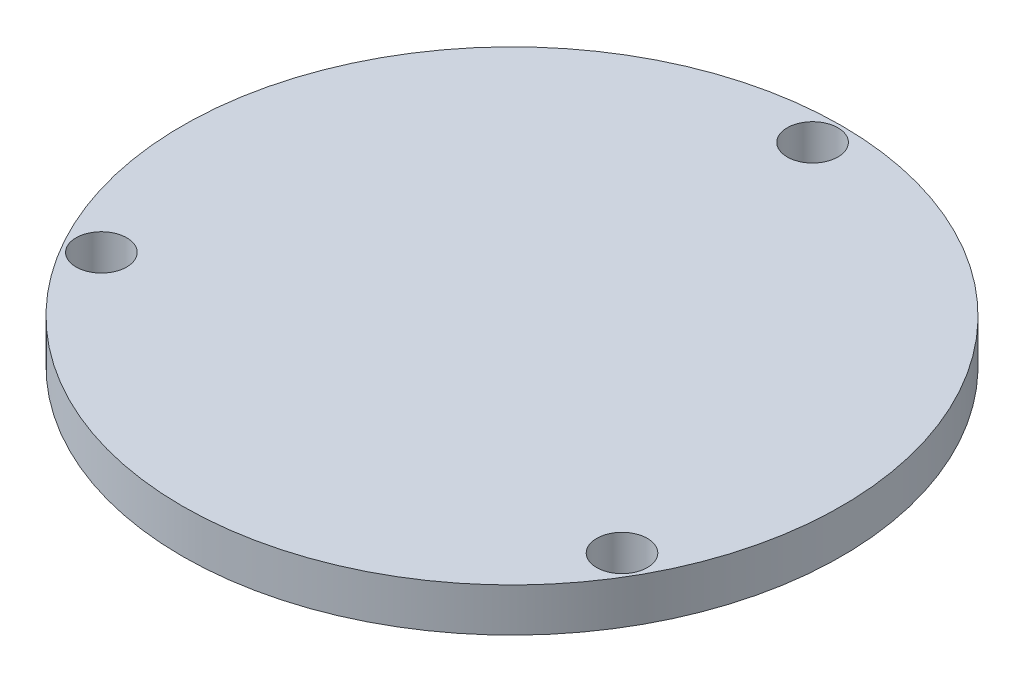
from build123d import *

# Parameters (mm, degrees)
OUTTER_R          = 11.557
BODY_DEPTH        = 1.524
SCREW_HOLES_COUNT = 3


with BuildPart() as part:
    # outter → Body (new body)
    with BuildSketch(Plane(origin=(0, 0, 0), x_dir=(1, 0, 0), z_dir=(0, 1, 0))):
        Circle(OUTTER_R)
    extrude(amount=-BODY_DEPTH)

    # Sketch12 → #0 Clearance Hole (revolve, cut)
    with BuildSketch(Plane(origin=(0, 0, -10.541), x_dir=(0, 0, 1), z_dir=(1, 0, 0))):
        Polygon((0, 0), (0, 2.05816509), (0.889, 1.524), (0.889, 0), align=None)
    f_0_clearance_hole = revolve(axis=Axis((0, 6.35, -10.541), (0, -1, 0)), mode=Mode.SUBTRACT)

    # Screw Holes: #0 Clearance Hole ×3 about axis
    screw_holes_axis = Axis((0, 0.0762, 0), (0, -1, 0))
    for i in range(1, SCREW_HOLES_COUNT):
        add(f_0_clearance_hole.rotate(screw_holes_axis, i * 360 / SCREW_HOLES_COUNT), mode=Mode.SUBTRACT)


solid = part.part
